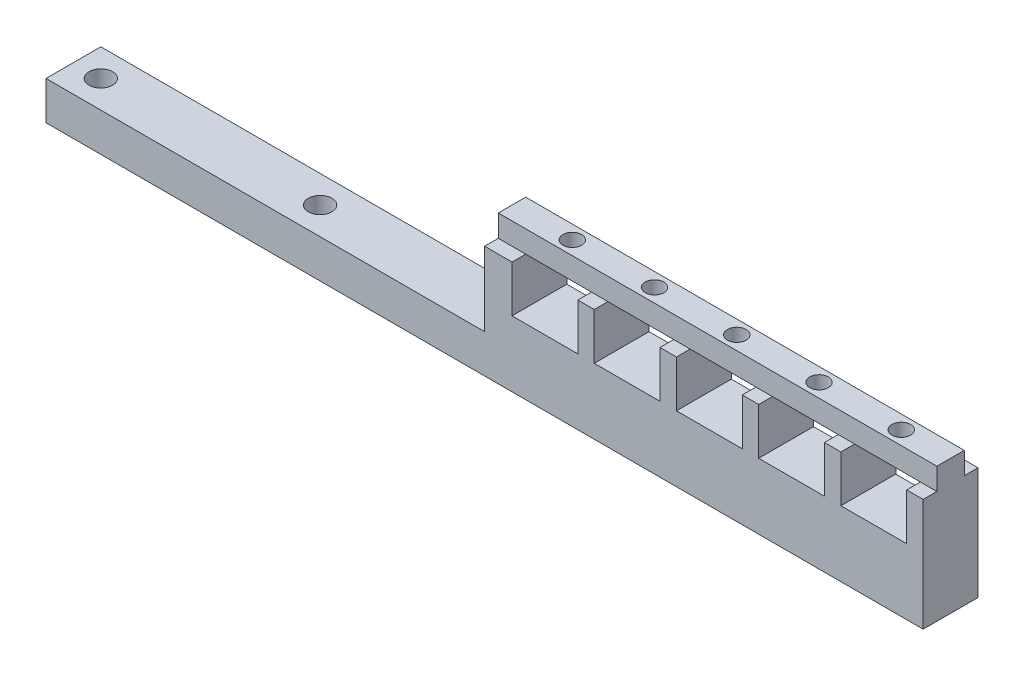
from build123d import *

# Parameters (mm, degrees)
SKETCH1_W           = 130
SKETCH1_H           = 10
SKETCH1_R           = 2.15
BOSS_EXTRUDE1_DEPTH = 7
SKETCH3_W           = 50
SKETCH3_H           = 10
BOSS_EXTRUDE2_DEPTH = 38.5
SKETCH9_W           = 10
SKETCH9_H           = 21
CUT_EXTRUDE5_DEPTH  = 139.095075944
SKETCH12_W          = 50
SKETCH12_H          = 4
CUT_EXTRUDE6_DEPTH  = 2.5
SKETCH13_W          = 50
SKETCH13_H          = 4
CUT_EXTRUDE7_DEPTH  = 2.5
SKETCH14_W          = 12
SKETCH14_H          = 8.5
CUT_EXTRUDE9_DEPTH  = 133.665933834
SKETCH15_R          = 1.7
CUT_EXTRUDE10_DEPTH = 132.98579469
BOSS_EXTRUDE4_DEPTH = 30
SKETCH20_W          = 12
SKETCH20_H          = 8.5
CUT_EXTRUDE14_DEPTH = 163.173518183
SKETCH21_W          = 12
SKETCH21_H          = 8.5
CUT_EXTRUDE15_DEPTH = 163.173518183
SKETCH22_R          = 1.7
CUT_EXTRUDE16_DEPTH = 10
SKETCH23_R          = 1.7
CUT_EXTRUDE17_DEPTH = 10


with BuildPart() as part:
    # Sketch1 → Boss-Extrude1 (new body)
    with BuildSketch(Plane(origin=(0, 0, 0), x_dir=(1, 0, 0), z_dir=(0, 1, 0))):
        with Locations((65, -5)):
            Rectangle(SKETCH1_W, SKETCH1_H)
        with Locations((5, -5)):
            Circle(SKETCH1_R, mode=Mode.SUBTRACT)
        with Locations((45, -5)):
            Circle(SKETCH1_R, mode=Mode.SUBTRACT)
    extrude(amount=BOSS_EXTRUDE1_DEPTH)

    # Sketch3 → Boss-Extrude2 (add)
    with BuildSketch(Plane(origin=(0, 7, 0), x_dir=(1, 0, 0), z_dir=(0, 1, 0))):
        with Locations((105, -5)):
            Rectangle(SKETCH3_W, SKETCH3_H)
    extrude(amount=BOSS_EXTRUDE2_DEPTH)

    # Sketch9 → Cut-Extrude5 (cut, through all)
    with BuildSketch(Plane(origin=(130, 0, 0), x_dir=(0, 0, -1), z_dir=(1, 0, 0))):
        with Locations((-5, 35)):
            Rectangle(SKETCH9_W, SKETCH9_H)
    extrude(amount=-CUT_EXTRUDE5_DEPTH, mode=Mode.SUBTRACT)

    # Sketch12 → Cut-Extrude6 (cut)
    with BuildSketch(Plane.XY.offset(10)):
        with Locations((105, 22.5)):
            Rectangle(SKETCH12_W, SKETCH12_H)
    extrude(amount=-CUT_EXTRUDE6_DEPTH, mode=Mode.SUBTRACT)

    # Sketch13 → Cut-Extrude7 (cut)
    with BuildSketch(Plane(origin=(0, 0, 0), x_dir=(-1, 0, 0), z_dir=(0, 0, -1))):
        with Locations((-105, 22.5)):
            Rectangle(SKETCH13_W, SKETCH13_H)
    extrude(amount=-CUT_EXTRUDE7_DEPTH, mode=Mode.SUBTRACT)

    # Sketch14 → Cut-Extrude9 (cut, through all)
    with BuildSketch(Plane.XY.offset(10)):
        with Locations((121, 16.25)):
            Rectangle(SKETCH14_W, SKETCH14_H)
        with Locations((91, 16.25)):
            Rectangle(SKETCH14_W, SKETCH14_H)
        with Locations((106, 16.25)):
            Rectangle(SKETCH14_W, SKETCH14_H)
    extrude(amount=-CUT_EXTRUDE9_DEPTH, mode=Mode.SUBTRACT)

    # Sketch15 → Cut-Extrude10 (cut, through all)
    with BuildSketch(Plane(origin=(0, 20.5, 0), x_dir=(-1, 0, 0), z_dir=(0, -1, 0))):
        with Locations((-121, -5)):
            Circle(SKETCH15_R)
        with Locations((-106, -5)):
            Circle(SKETCH15_R)
        with Locations((-91, -5)):
            Circle(SKETCH15_R)
    extrude(amount=-CUT_EXTRUDE10_DEPTH, mode=Mode.SUBTRACT)

    # Sketch19 → Boss-Extrude4 (add)
    with BuildSketch(Plane(origin=(130, 0, 0), x_dir=(0, 0, -1), z_dir=(1, 0, 0))):
        Polygon((-10, 0), (-10, 20.5), (-7.5, 20.5), (-7.5, 24.5), (-2.5, 24.5), (-2.5, 20.5), (0, 20.5), (0, 0), align=None)
    extrude(amount=BOSS_EXTRUDE4_DEPTH)

    # Sketch20 → Cut-Extrude14 (cut, through all)
    with BuildSketch(Plane(origin=(0, 0, 0), x_dir=(-1, 0, 0), z_dir=(0, 0, -1))):
        with Locations((-136, 16.25)):
            Rectangle(SKETCH20_W, SKETCH20_H)
    extrude(amount=-CUT_EXTRUDE14_DEPTH, mode=Mode.SUBTRACT)

    # Sketch21 → Cut-Extrude15 (cut, through all)
    with BuildSketch(Plane(origin=(0, 0, 0), x_dir=(-1, 0, 0), z_dir=(0, 0, -1))):
        with Locations((-151, 16.25)):
            Rectangle(SKETCH21_W, SKETCH21_H)
    extrude(amount=-CUT_EXTRUDE15_DEPTH, mode=Mode.SUBTRACT)

    # Sketch22 → Cut-Extrude16 (cut)
    with BuildSketch(Plane(origin=(0, 24.5, 0), x_dir=(1, 0, 0), z_dir=(0, 1, 0))):
        with Locations((136, -5)):
            Circle(SKETCH22_R)
    extrude(amount=-CUT_EXTRUDE16_DEPTH, mode=Mode.SUBTRACT)

    # Sketch23 → Cut-Extrude17 (cut)
    with BuildSketch(Plane(origin=(0, 24.5, 0), x_dir=(1, 0, 0), z_dir=(0, 1, 0))):
        with Locations((151, -5)):
            Circle(SKETCH23_R)
    extrude(amount=-CUT_EXTRUDE17_DEPTH, mode=Mode.SUBTRACT)


solid = part.part
